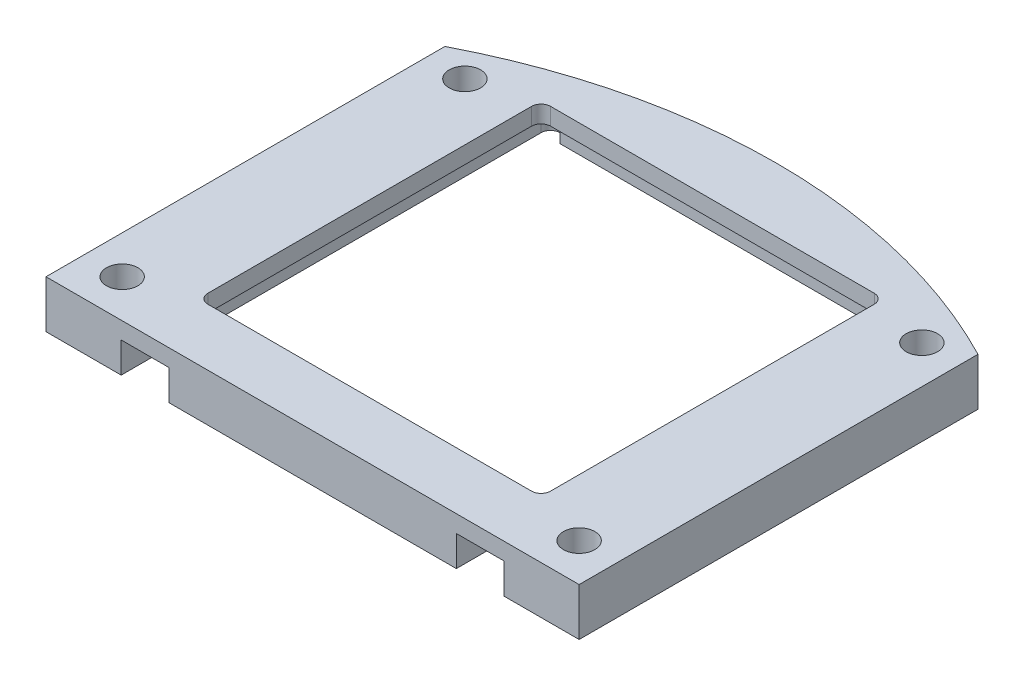
from build123d import *

# Parameters (mm, degrees)
SKETCH1_R           = 1.65
BOSS_EXTRUDE1_DEPTH = 5
SKETCH2_W           = 36
SKETCH2_H           = 36
BOSS_EXTRUDE2_DEPTH = 1.8
CUT_EXTRUDE1_REACH  = 58.399
SKETCH3_W           = 5
SKETCH3_H           = 3.2
FILLET1_R           = 1


with BuildPart() as part:
    # Sketch1 → Boss-Extrude1 (new body)
    with BuildSketch(Plane(origin=(0, 0, 0), x_dir=(1, 0, 0), z_dir=(0, 1, 0))):
        with BuildLine():
            Line((-28, -24), (28, -24))
            Line((28, -24), (28, 17.89570392))
            ThreePointArc((28, 17.89570392), (0, 24.701428863), (-28, 17.89570392))
            Line((-28, 17.89570392), (-28, -24))
        make_face()
        with Locations(Location((-24, 16, 0), (0, 0, 270))):
            Circle(SKETCH1_R, mode=Mode.SUBTRACT)
        with Locations(Location((24, 16, 0), (0, 0, 270))):
            Circle(SKETCH1_R, mode=Mode.SUBTRACT)
        with Locations(Location((-24, -20, 0), (0, 0, 270))):
            Circle(SKETCH1_R, mode=Mode.SUBTRACT)
        with Locations(Location((24, -20, 0), (0, 0, 270))):
            Circle(SKETCH1_R, mode=Mode.SUBTRACT)
        Polygon((20.1, -20.1), (20.1, 21.1), (18.1, 21.1), (18.1, 20.1), (-18.1, 20.1), (-18.1, 21.1), (-20.1, 21.1), (-20.1, -20.1), align=None, mode=Mode.SUBTRACT)
    extrude(amount=BOSS_EXTRUDE1_DEPTH)

    # Sketch2 → Boss-Extrude2 (add)
    with BuildSketch(Plane(origin=(0, 5, 0), x_dir=(1, 0, 0), z_dir=(0, 1, 0))):
        Polygon((-20.1, 21.1), (-20.1, -20.1), (20.1, -20.1), (20.1, 21.1), (18.1, 21.1), (18.1, 20.1), (-18.1, 20.1), (-18.1, 21.1), align=None)
        Rectangle(SKETCH2_W, SKETCH2_H, mode=Mode.SUBTRACT)
    extrude(amount=-BOSS_EXTRUDE2_DEPTH)

    # Sketch3 → Cut-Extrude1 (cut, up to next)
    with BuildSketch(Plane.XY.offset(24), mode=Mode.PRIVATE) as cut_extrude1_sk1:
        with Locations((-17.6, 1.6)):
            Rectangle(SKETCH3_W, SKETCH3_H)
    cut_extrude1_tool1 = extrude(cut_extrude1_sk1.sketch, amount=-CUT_EXTRUDE1_REACH, mode=Mode.PRIVATE) & part.part
    # Sketch3 → Cut-Extrude1 (cut, up to next)
    with BuildSketch(Plane.XY.offset(24), mode=Mode.PRIVATE) as cut_extrude1_sk2:
        with Locations((17.6, 1.6)):
            Rectangle(SKETCH3_W, SKETCH3_H)
    cut_extrude1_tool2 = extrude(cut_extrude1_sk2.sketch, amount=-CUT_EXTRUDE1_REACH, mode=Mode.PRIVATE) & part.part
    add(cut_extrude1_tool1.solids().sort_by_distance((-17.6, 1.6, 24))[0], mode=Mode.SUBTRACT)
    add(cut_extrude1_tool2.solids().sort_by_distance((17.6, 1.6, 24))[0], mode=Mode.SUBTRACT)

    # Fillet1
    fillet1_edges = [part.edges().sort_by_distance(p)[0] for p in [
        (-18, 4.1, 18),
        (18, 4.1, 18),
        (18, 4.1, -18),
        (-18, 4.1, -18),
        (-20.1, 1.6, -21.1),
        (-18.1, 1.6, -21.1),
        (18.1, 1.6, -21.1),
        (20.1, 1.6, -21.1),
    ]]
    fillet(fillet1_edges, radius=FILLET1_R - 0.0001)  # a hair under: the kernel refuses the full size


solid = part.part
